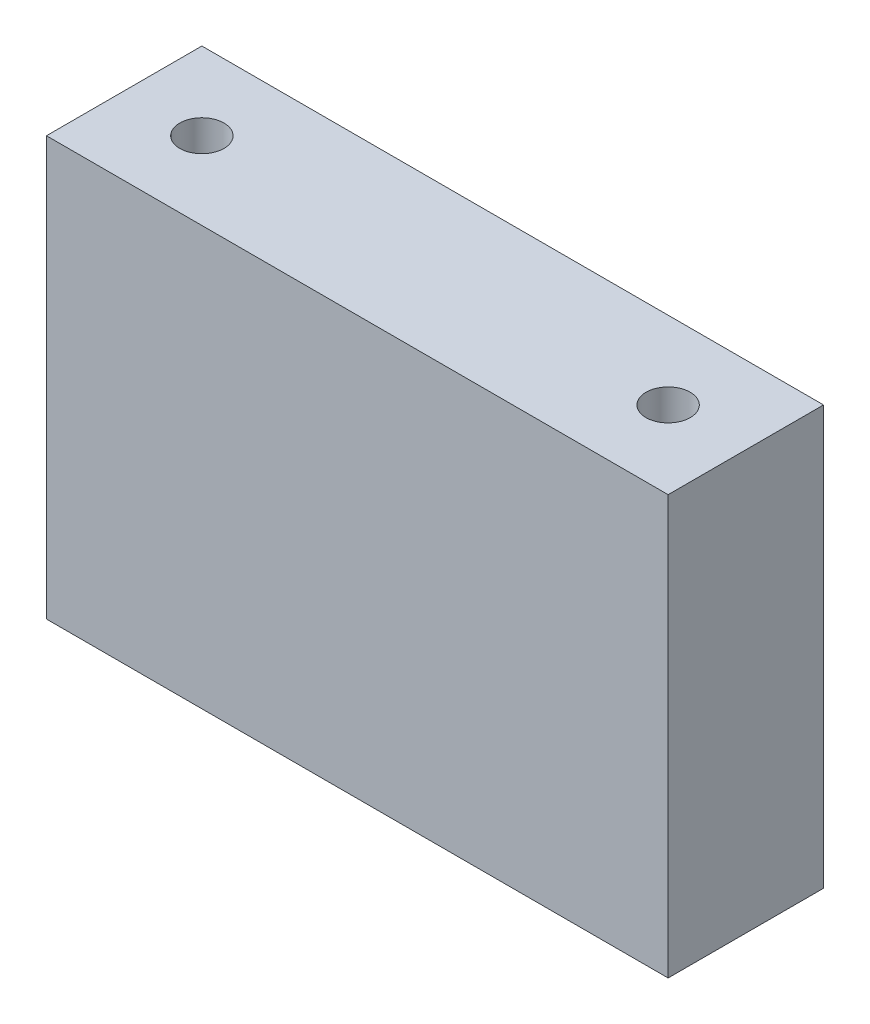
from build123d import *

# Parameters (mm, degrees)
SKETCH1_W                 = 38.1
SKETCH1_H                 = 25.654
BOSS_EXTRUDE1_DEPTH       = 9.525
F_6_32_TAPPED_HOLE1_D     = 2.7051
F_6_32_TAPPED_HOLE1_DEPTH = 7.62
F_6_32_TAPPED_HOLE1_TIP   = 0.81269403
F_6_32_TAPPED_HOLE2_D     = 2.7051
F_6_32_TAPPED_HOLE2_DEPTH = 9.38784
F_6_32_TAPPED_HOLE2_TIP   = 0.81269403


with BuildPart() as part:
    # Sketch1 → Boss-Extrude1 (new body)
    with BuildSketch(Plane.XY):
        Rectangle(SKETCH1_W, SKETCH1_H)
    extrude(amount=BOSS_EXTRUDE1_DEPTH)

    # #6-32 Tapped Hole1
    with Locations(Plane(origin=(0, 12.827, 0), x_dir=(1, 0, 0), z_dir=(0, 1, 0))):
        with Locations((-14.2875, -4.7625), (14.2875, -4.7625)):
            Hole(F_6_32_TAPPED_HOLE1_D / 2, depth=F_6_32_TAPPED_HOLE1_DEPTH)
            with Locations((0, 0, -(F_6_32_TAPPED_HOLE1_DEPTH + F_6_32_TAPPED_HOLE1_TIP / 2))):  # 118° drill point
                Cone(0, F_6_32_TAPPED_HOLE1_D / 2, F_6_32_TAPPED_HOLE1_TIP, mode=Mode.SUBTRACT)

    # #6-32 Tapped Hole2
    with Locations(Plane(origin=(0, -12.827, 0), x_dir=(-1, 0, 0), z_dir=(0, -1, 0))):
        with Locations((-14.2875, -4.7625), (14.2875, -4.7625)):
            Hole(F_6_32_TAPPED_HOLE2_D / 2, depth=F_6_32_TAPPED_HOLE2_DEPTH)
            with Locations((0, 0, -(F_6_32_TAPPED_HOLE2_DEPTH + F_6_32_TAPPED_HOLE2_TIP / 2))):  # 118° drill point
                Cone(0, F_6_32_TAPPED_HOLE2_D / 2, F_6_32_TAPPED_HOLE2_TIP, mode=Mode.SUBTRACT)


solid = part.part
